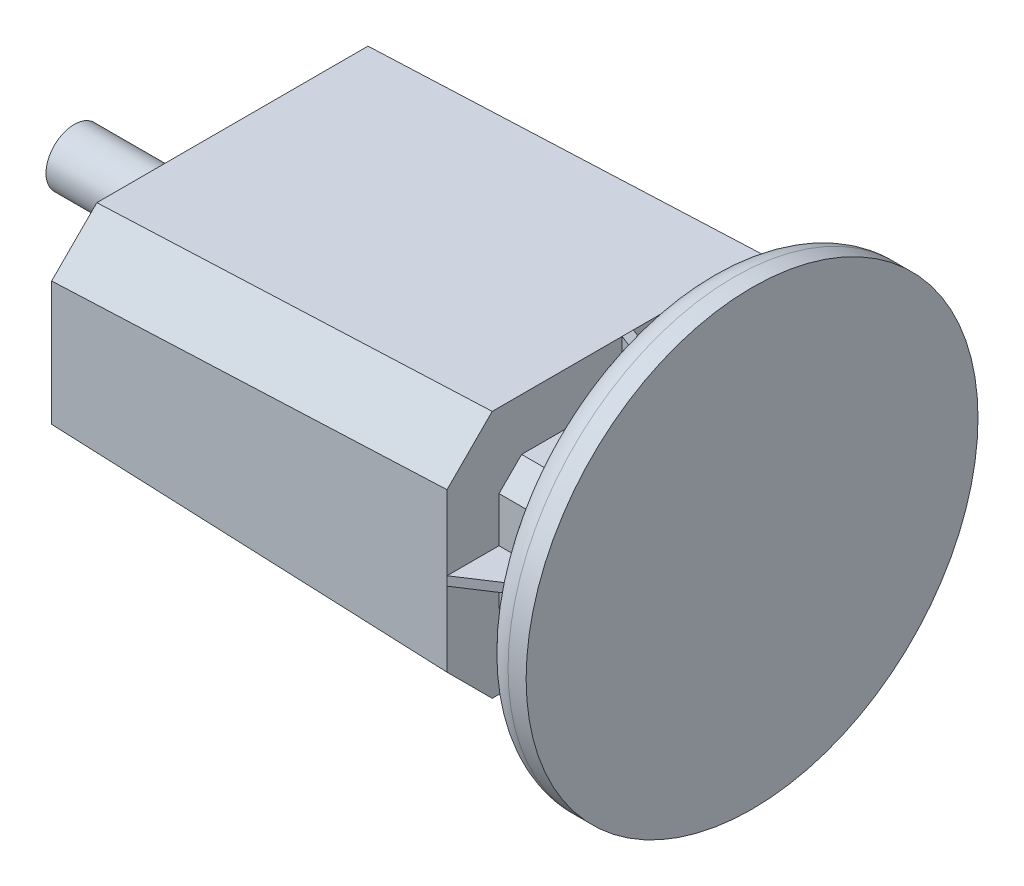
from build123d import *

# Parameters (mm, degrees)
BOSS_EXTRU_1_DEPTH           = 160
ESQUISSE3_R                  = 12.5
BOSS_EXTRU_3_DEPTH           = 70
CHANFREIN9_SIZE              = 20
BOSS_EXTRU_4_DEPTH           = 35
BOSS_EXTRU_5_DEPTH           = 2.5
R_P_TITION_START             = 77.5
R_P_TITION_CIRCULAIRE1_DEPTH = 5
BOSS_EXTRU_6_START           = -32
BOSS_EXTRU_6_DEPTH           = 2
R_P_TITION_START_2           = -2
R_P_TITION_CIRCULAIRE2_DEPTH = 4
ESQUISSE10_R                 = 100
BOSS_EXTRU_7_DEPTH           = 20
CONG_3_R                     = 12


# Read off the part's stored shape, not the designer's step: Répétition circulaire1, Répétition circulaire2
with BuildPart() as part:
    # Esquisse1 → Boss.-Extru.1 (new body)
    with BuildSketch(Plane.XY):
        Polygon((0, -47.5), (0, 47.5), (175, 55), (175, -55), align=None)
    extrude(amount=BOSS_EXTRU_1_DEPTH)

    # Esquisse3 → Boss.-Extru.3 (add)
    with BuildSketch(Plane.ZY):
        with Locations(Location((80, 0, 0), (0, 0, 180))):
            Circle(ESQUISSE3_R)
    extrude(amount=BOSS_EXTRU_3_DEPTH)

    # Chanfrein9
    chanfrein9_edges = [part.edges().sort_by_distance(p)[0] for p in [
        (87.5, -51.25, 160),
        (87.5, 51.25, 160),
        (87.5, -51.25, 0),
        (87.5, 51.25, 0),
    ]]
    chamfer(chanfrein9_edges, length=CHANFREIN9_SIZE)

    # Esquisse4 → Boss.-Extru.4 (add)
    with BuildSketch(Plane(origin=(175, 0, 0), x_dir=(0, 0, -1), z_dir=(1, 0, 0))):
        Polygon((-127, 32), (-33, 32), (-23, 22), (-23, -22), (-33, -32), (-127, -32), (-137, -22), (-137, 22), align=None)
    extrude(amount=BOSS_EXTRU_4_DEPTH)

    # Esquisse5 → Boss.-Extru.5 (add, symmetric)
    with BuildSketch(Plane.XY.offset(80)):
        Polygon((175, 55), (210, 32), (175, 32), align=None)
    extrude(amount=BOSS_EXTRU_5_DEPTH, both=True)

    # Répétition circulaire1 outline → Répétition circulaire1 (add)
    with BuildSketch(Plane.XY.offset(R_P_TITION_START)):
        Polygon((175, -32), (175, -55), (210, -32), align=None)
    extrude(amount=R_P_TITION_CIRCULAIRE1_DEPTH)

    # Esquisse8 → Boss.-Extru.6 (add, symmetric)
    with BuildSketch(Plane.XZ.offset(32).offset(BOSS_EXTRU_6_START)):
        Polygon((175, 160), (210, 137), (175, 137), align=None)
    extrude(amount=BOSS_EXTRU_6_DEPTH, both=True)

    # Répétition circulaire2 outline → Répétition circulaire2 (add)
    with BuildSketch(Plane(origin=(0, 0, 0), x_dir=(1, 0, 0), z_dir=(0, 1, 0)).offset(R_P_TITION_START_2)):
        Polygon((175, -23), (210, -23), (175, 0), align=None)
    extrude(amount=R_P_TITION_CIRCULAIRE2_DEPTH)

    # Esquisse10 → Boss.-Extru.7 (add)
    with BuildSketch(Plane(origin=(210, 0, 0), x_dir=(0, 0, -1), z_dir=(1, 0, 0))):
        with Locations((-80, 0)):
            Circle(ESQUISSE10_R)
    extrude(amount=BOSS_EXTRU_7_DEPTH)

    # Congé3
    cong_3_edges = [part.edges().sort_by_distance(p)[0] for p in [
        (210, 0, 180),
    ]]
    fillet(cong_3_edges, radius=CONG_3_R)


solid = part.part
